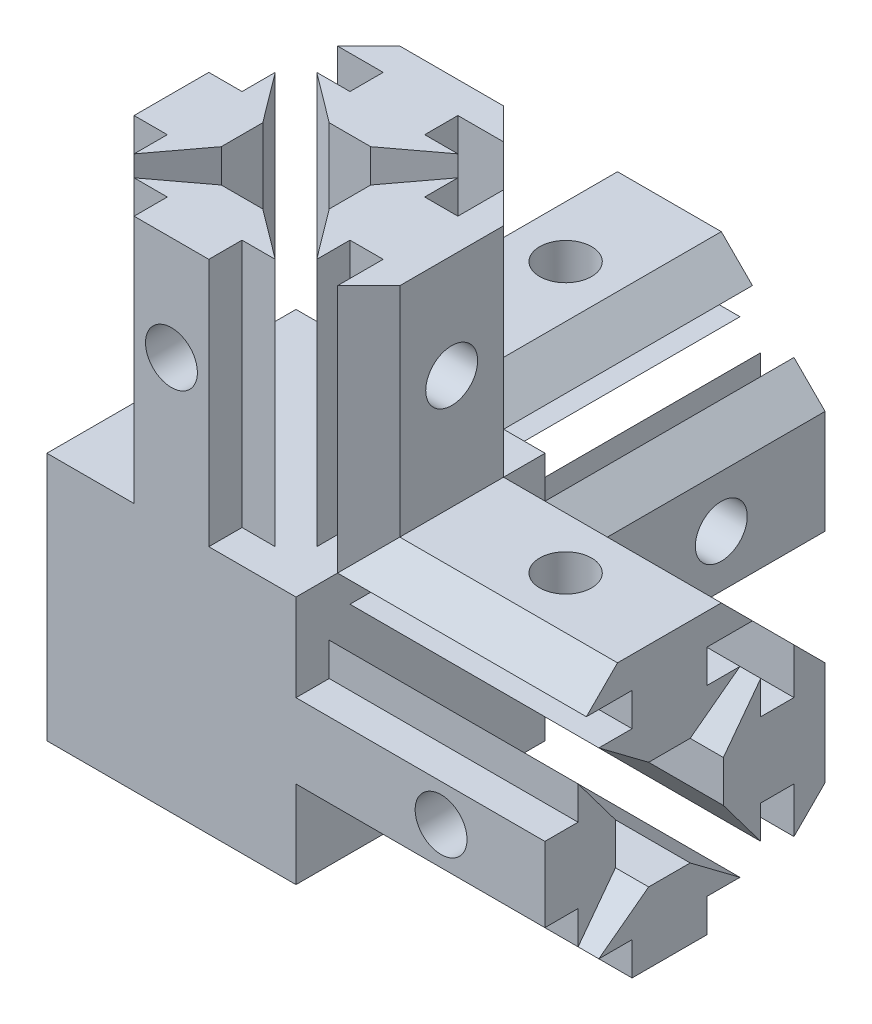
from build123d import *

# Parameters (mm, degrees)
ESQUISSE1_W                             = 12
ESQUISSE1_H                             = 12
BOSS_EXTRU_1_DEPTH                      = 6
BOSS_EXTRU_6_DEPTH                      = 12
ESQUISSE15_R                            = 1.25
ENL_V_MAT_EXTRU_13_DEPTH                = 25
R_P_TITION_CIRCULAIRE10_COUNT           = 4
R_P_TITION_CIRCULAIRE11_COPY_1_DEPTH    = 12
R_P_TITION_CIRCULAIRE11_COPY_2_DEPTH    = 12
R_P_TITION_CIRCULAIRE11_COPY_3_DEPTH    = 12
R_P_TITION_CIRCULAIRE11_COPY_4_SKETCH_R = 1.25
R_P_TITION_CIRCULAIRE11_COPY_4_DEPTH    = 25
R_P_TITION_CIRCULAIRE11_COPY_5_SKETCH_R = 1.25
R_P_TITION_CIRCULAIRE11_COPY_5_DEPTH    = 25
R_P_TITION_CIRCULAIRE11_COPY_6_SKETCH_R = 1.25
R_P_TITION_CIRCULAIRE11_COPY_6_DEPTH    = 25
R_P_TITION_CIRCULAIRE11_COPY_7_DEPTH    = 12
R_P_TITION_CIRCULAIRE11_COPY_8_SKETCH_R = 1.25
R_P_TITION_CIRCULAIRE11_COPY_8_DEPTH    = 25
R_P_TITION_CIRCULAIRE12_COPY_1_DEPTH    = 12
R_P_TITION_CIRCULAIRE12_COPY_2_DEPTH    = 12
R_P_TITION_CIRCULAIRE12_COPY_3_DEPTH    = 12
R_P_TITION_CIRCULAIRE12_COPY_4_SKETCH_R = 1.25
R_P_TITION_CIRCULAIRE12_COPY_4_DEPTH    = 25
R_P_TITION_CIRCULAIRE12_COPY_5_SKETCH_R = 1.25
R_P_TITION_CIRCULAIRE12_COPY_5_DEPTH    = 25
R_P_TITION_CIRCULAIRE12_COPY_6_SKETCH_R = 1.25
R_P_TITION_CIRCULAIRE12_COPY_6_DEPTH    = 25
R_P_TITION_CIRCULAIRE12_COPY_7_DEPTH    = 12
R_P_TITION_CIRCULAIRE12_COPY_8_SKETCH_R = 1.25
R_P_TITION_CIRCULAIRE12_COPY_8_DEPTH    = 25
ESQUISSE11_W                            = 5
ESQUISSE11_H                            = 30
ENL_V_MAT_EXTRU_8_DEPTH                 = 37.014168045
ESQUISSE12_W                            = 30
ESQUISSE12_H                            = 5
ENL_V_MAT_EXTRU_9_DEPTH                 = 37.014168045
ESQUISSE13_W                            = 5
ESQUISSE13_H                            = 21.99
ENL_V_MAT_EXTRU_11_DEPTH                = 35.968561595


with BuildPart() as part:
    # Esquisse1 → Boss.-Extru.1 (new, symmetric)
    with BuildSketch(Plane.XY):
        Rectangle(ESQUISSE1_W, ESQUISSE1_H)
    extrude(amount=BOSS_EXTRU_1_DEPTH, both=True)

    # Esquisse8 → Boss.-Extru.6 (add)
    with BuildSketch(Plane(origin=(0, 5.99, 0), x_dir=(1, 0, 0), z_dir=(0, 1, 0))):
        Polygon((-6, 1.8), (-4.4, 1.8), (-4.4, 3.4), (-2.6, 1), (-2.6, -1), (-4.4, -3.4), (-4.4, -1.8), (-6, -1.8), (-6, -4), (-7.5, -2.5), (-7.5, 2.5), (-6, 4), align=None)
    boss_extru_6 = extrude(amount=BOSS_EXTRU_6_DEPTH)

    # Esquisse15 → Enlèv. mat.-Extru.13 (cut, symmetric)
    with BuildSketch(Plane(origin=(-2.6, 0, 0), x_dir=(0, 0, -1), z_dir=(1, 0, 0))):
        with Locations((0, 12.99)):
            Circle(ESQUISSE15_R)
    enl_v_mat_extru_13 = extrude(amount=ENL_V_MAT_EXTRU_13_DEPTH, both=True, mode=Mode.SUBTRACT)

    # Répétition circulaire10: Boss.-Extru.6, Enlèv. mat.-Extru.13 ×4 about axis
    r_p_tition_circulaire10_axis = Axis((0, 17.691021356, 0), (0, -1, 0))
    add([boss_extru_6.rotate(r_p_tition_circulaire10_axis, i * 360 / R_P_TITION_CIRCULAIRE10_COUNT) for i in range(1, R_P_TITION_CIRCULAIRE10_COUNT)])
    add([enl_v_mat_extru_13.rotate(r_p_tition_circulaire10_axis, i * 360 / R_P_TITION_CIRCULAIRE10_COUNT) for i in range(1, R_P_TITION_CIRCULAIRE10_COUNT)], mode=Mode.SUBTRACT)

    # Répétition circulaire11 copy 1 sketch → Répétition circulaire11 copy 1 (add)
    with BuildSketch(Plane.YX.offset(5.99)):
        Polygon((-6, 1.8), (-4.4, 1.8), (-4.4, 3.4), (-2.6, 1), (-2.6, -1), (-4.4, -3.4), (-4.4, -1.8), (-6, -1.8), (-6, -4), (-7.5, -2.5), (-7.5, 2.5), (-6, 4), align=None)
    extrude(amount=R_P_TITION_CIRCULAIRE11_COPY_1_DEPTH)

    # Répétition circulaire11 copy 2 sketch → Répétition circulaire11 copy 2 (add)
    with BuildSketch(Plane(origin=(0, 0, -5.99), x_dir=(-1, 0, 0), z_dir=(0, 0, -1))):
        Polygon((-6, 1.8), (-4.4, 1.8), (-4.4, 3.4), (-2.6, 1), (-2.6, -1), (-4.4, -3.4), (-4.4, -1.8), (-6, -1.8), (-6, -4), (-7.5, -2.5), (-7.5, 2.5), (-6, 4), align=None)
    extrude(amount=R_P_TITION_CIRCULAIRE11_COPY_2_DEPTH)

    # Répétition circulaire11 copy 3 sketch → Répétition circulaire11 copy 3 (add)
    with BuildSketch(Plane(origin=(0, 0, -5.99), x_dir=(0, -1, 0), z_dir=(0, 0, -1))):
        Polygon((-6, 1.8), (-4.4, 1.8), (-4.4, 3.4), (-2.6, 1), (-2.6, -1), (-4.4, -3.4), (-4.4, -1.8), (-6, -1.8), (-6, -4), (-7.5, -2.5), (-7.5, 2.5), (-6, 4), align=None)
    extrude(amount=R_P_TITION_CIRCULAIRE11_COPY_3_DEPTH)

    # Répétition circulaire11 copy 4 sketch → Répétition circulaire11 copy 4 (cut, symmetric)
    with BuildSketch(Plane(origin=(0, -2.6, 0), x_dir=(1, 0, 0), z_dir=(0, 1, 0))):
        with Locations((0, 12.99)):
            Circle(R_P_TITION_CIRCULAIRE11_COPY_4_SKETCH_R)
    extrude(amount=R_P_TITION_CIRCULAIRE11_COPY_4_DEPTH, both=True, mode=Mode.SUBTRACT)

    # Répétition circulaire11 copy 5 sketch → Répétition circulaire11 copy 5 (cut, symmetric)
    with BuildSketch(Plane(origin=(2.6, 0, 0), x_dir=(0, 1, 0), z_dir=(-1, 0, 0))):
        with Locations((0, 12.99)):
            Circle(R_P_TITION_CIRCULAIRE11_COPY_5_SKETCH_R)
    extrude(amount=R_P_TITION_CIRCULAIRE11_COPY_5_DEPTH, both=True, mode=Mode.SUBTRACT)

    # Répétition circulaire11 copy 6 sketch → Répétition circulaire11 copy 6 (cut, symmetric)
    with BuildSketch(Plane(origin=(0, 2.6, 0), x_dir=(-1, 0, 0), z_dir=(0, -1, 0))):
        with Locations((0, 12.99)):
            Circle(R_P_TITION_CIRCULAIRE11_COPY_6_SKETCH_R)
    extrude(amount=R_P_TITION_CIRCULAIRE11_COPY_6_DEPTH, both=True, mode=Mode.SUBTRACT)

    # Répétition circulaire11 copy 7 sketch → Répétition circulaire11 copy 7 (add)
    with BuildSketch(Plane(origin=(0, 0, -5.99), x_dir=(1, 0, 0), z_dir=(0, 0, -1))):
        Polygon((-6, 1.8), (-4.4, 1.8), (-4.4, 3.4), (-2.6, 1), (-2.6, -1), (-4.4, -3.4), (-4.4, -1.8), (-6, -1.8), (-6, -4), (-7.5, -2.5), (-7.5, 2.5), (-6, 4), align=None)
    extrude(amount=R_P_TITION_CIRCULAIRE11_COPY_7_DEPTH)

    # Répétition circulaire11 copy 8 sketch → Répétition circulaire11 copy 8 (cut, symmetric)
    with BuildSketch(Plane(origin=(-2.6, 0, 0), x_dir=(0, -1, 0), z_dir=(1, 0, 0))):
        with Locations((0, 12.99)):
            Circle(R_P_TITION_CIRCULAIRE11_COPY_8_SKETCH_R)
    extrude(amount=R_P_TITION_CIRCULAIRE11_COPY_8_DEPTH, both=True, mode=Mode.SUBTRACT)

    # Répétition circulaire12 copy 1 sketch → Répétition circulaire12 copy 1 (add)
    with BuildSketch(Plane(origin=(5.99, 0, 0), x_dir=(0, 0, 1), z_dir=(1, 0, 0))):
        Polygon((-6, 1.8), (-4.4, 1.8), (-4.4, 3.4), (-2.6, 1), (-2.6, -1), (-4.4, -3.4), (-4.4, -1.8), (-6, -1.8), (-6, -4), (-7.5, -2.5), (-7.5, 2.5), (-6, 4), align=None)
    extrude(amount=R_P_TITION_CIRCULAIRE12_COPY_1_DEPTH)

    # Répétition circulaire12 copy 2 sketch → Répétition circulaire12 copy 2 (add)
    with BuildSketch(Plane.YZ.offset(5.99)):
        Polygon((-6, 1.8), (-4.4, 1.8), (-4.4, 3.4), (-2.6, 1), (-2.6, -1), (-4.4, -3.4), (-4.4, -1.8), (-6, -1.8), (-6, -4), (-7.5, -2.5), (-7.5, 2.5), (-6, 4), align=None)
    extrude(amount=R_P_TITION_CIRCULAIRE12_COPY_2_DEPTH)

    # Répétition circulaire12 copy 3 sketch → Répétition circulaire12 copy 3 (add)
    with BuildSketch(Plane(origin=(5.99, 0, 0), x_dir=(0, 0, -1), z_dir=(1, 0, 0))):
        Polygon((-6, 1.8), (-4.4, 1.8), (-4.4, 3.4), (-2.6, 1), (-2.6, -1), (-4.4, -3.4), (-4.4, -1.8), (-6, -1.8), (-6, -4), (-7.5, -2.5), (-7.5, 2.5), (-6, 4), align=None)
    extrude(amount=R_P_TITION_CIRCULAIRE12_COPY_3_DEPTH)

    # Répétition circulaire12 copy 4 sketch → Répétition circulaire12 copy 4 (cut, symmetric)
    with BuildSketch(Plane(origin=(0, 0, -2.6), x_dir=(0, -1, 0), z_dir=(0, 0, 1))):
        with Locations((0, 12.99)):
            Circle(R_P_TITION_CIRCULAIRE12_COPY_4_SKETCH_R)
    extrude(amount=R_P_TITION_CIRCULAIRE12_COPY_4_DEPTH, both=True, mode=Mode.SUBTRACT)

    # Répétition circulaire12 copy 5 sketch → Répétition circulaire12 copy 5 (cut, symmetric)
    with BuildSketch(Plane.ZX.offset(-2.6)):
        with Locations((0, 12.99)):
            Circle(R_P_TITION_CIRCULAIRE12_COPY_5_SKETCH_R)
    extrude(amount=R_P_TITION_CIRCULAIRE12_COPY_5_DEPTH, both=True, mode=Mode.SUBTRACT)

    # Répétition circulaire12 copy 6 sketch → Répétition circulaire12 copy 6 (cut, symmetric)
    with BuildSketch(Plane.YX.offset(-2.6)):
        with Locations((0, 12.99)):
            Circle(R_P_TITION_CIRCULAIRE12_COPY_6_SKETCH_R)
    extrude(amount=R_P_TITION_CIRCULAIRE12_COPY_6_DEPTH, both=True, mode=Mode.SUBTRACT)

    # Répétition circulaire12 copy 7 sketch → Répétition circulaire12 copy 7 (add)
    with BuildSketch(Plane(origin=(5.99, 0, 0), x_dir=(0, -1, 0), z_dir=(1, 0, 0))):
        Polygon((-6, 1.8), (-4.4, 1.8), (-4.4, 3.4), (-2.6, 1), (-2.6, -1), (-4.4, -3.4), (-4.4, -1.8), (-6, -1.8), (-6, -4), (-7.5, -2.5), (-7.5, 2.5), (-6, 4), align=None)
    extrude(amount=R_P_TITION_CIRCULAIRE12_COPY_7_DEPTH)

    # Répétition circulaire12 copy 8 sketch → Répétition circulaire12 copy 8 (cut, symmetric)
    with BuildSketch(Plane(origin=(0, 2.6, 0), x_dir=(0, 0, -1), z_dir=(0, -1, 0))):
        with Locations((0, 12.99)):
            Circle(R_P_TITION_CIRCULAIRE12_COPY_8_SKETCH_R)
    extrude(amount=R_P_TITION_CIRCULAIRE12_COPY_8_DEPTH, both=True, mode=Mode.SUBTRACT)

    # Esquisse11 → Enlèv. mat.-Extru.8 (cut, through all)
    with BuildSketch(Plane(origin=(0, 17.99, 0), x_dir=(1, 0, 0), z_dir=(0, 1, 0))):
        with Locations((-8.5, 9)):
            Rectangle(ESQUISSE11_W, ESQUISSE11_H)
    extrude(amount=-ENL_V_MAT_EXTRU_8_DEPTH, mode=Mode.SUBTRACT)

    # Esquisse12 → Enlèv. mat.-Extru.9 (cut, through all)
    with BuildSketch(Plane(origin=(0, 0, -17.99), x_dir=(-1, 0, 0), z_dir=(0, 0, -1))):
        with Locations((-9, -8.5)):
            Rectangle(ESQUISSE12_W, ESQUISSE12_H)
    extrude(amount=-ENL_V_MAT_EXTRU_9_DEPTH, mode=Mode.SUBTRACT)

    # Esquisse13 → Enlèv. mat.-Extru.11 (cut, through all)
    with BuildSketch(Plane(origin=(17.99, 0, 0), x_dir=(0, 0, -1), z_dir=(1, 0, 0))):
        with Locations((-8.5, 6.995)):
            Rectangle(ESQUISSE13_W, ESQUISSE13_H)
    extrude(amount=-ENL_V_MAT_EXTRU_11_DEPTH, mode=Mode.SUBTRACT)


solid = part.part
